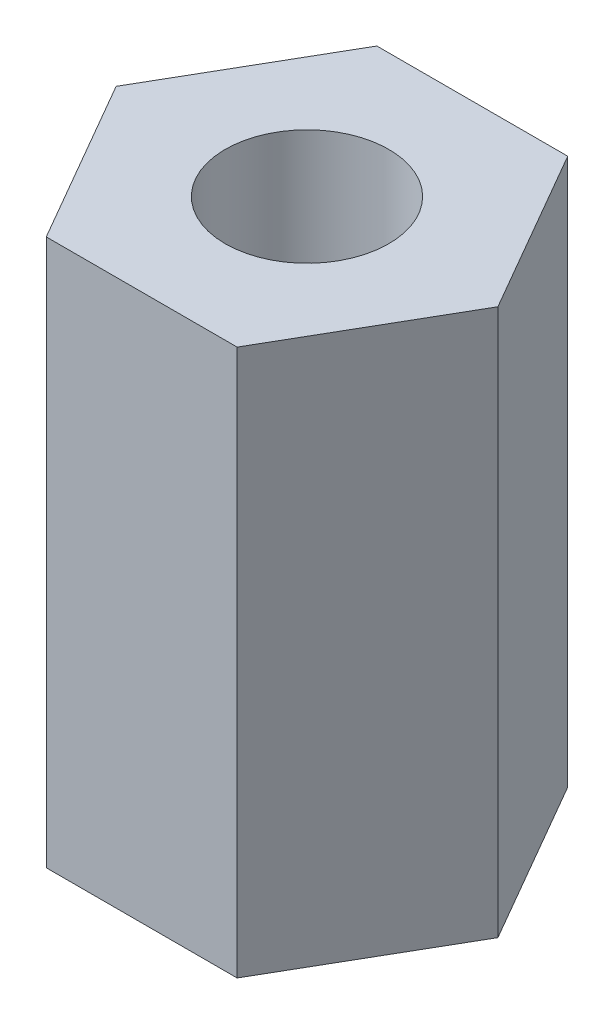
from build123d import *

# Parameters (mm, degrees)
SKETCH1_R           = 2.9845
BOSS_EXTRUDE1_DEPTH = 9.9695


with BuildPart() as part:
    # Sketch1 → Boss-Extrude1 (new, symmetric)
    with BuildSketch(Plane(origin=(0, 0, 0), x_dir=(1, 0, 0), z_dir=(0, 1, 0))):
        Polygon((6.965730998, 0), (3.482865499, 6.0325), (-3.482865499, 6.0325), (-6.965730998, 0), (-3.482865499, -6.0325), (3.482865499, -6.0325), align=None)
        Circle(SKETCH1_R, mode=Mode.SUBTRACT)
    extrude(amount=BOSS_EXTRUDE1_DEPTH, both=True)


solid = part.part
